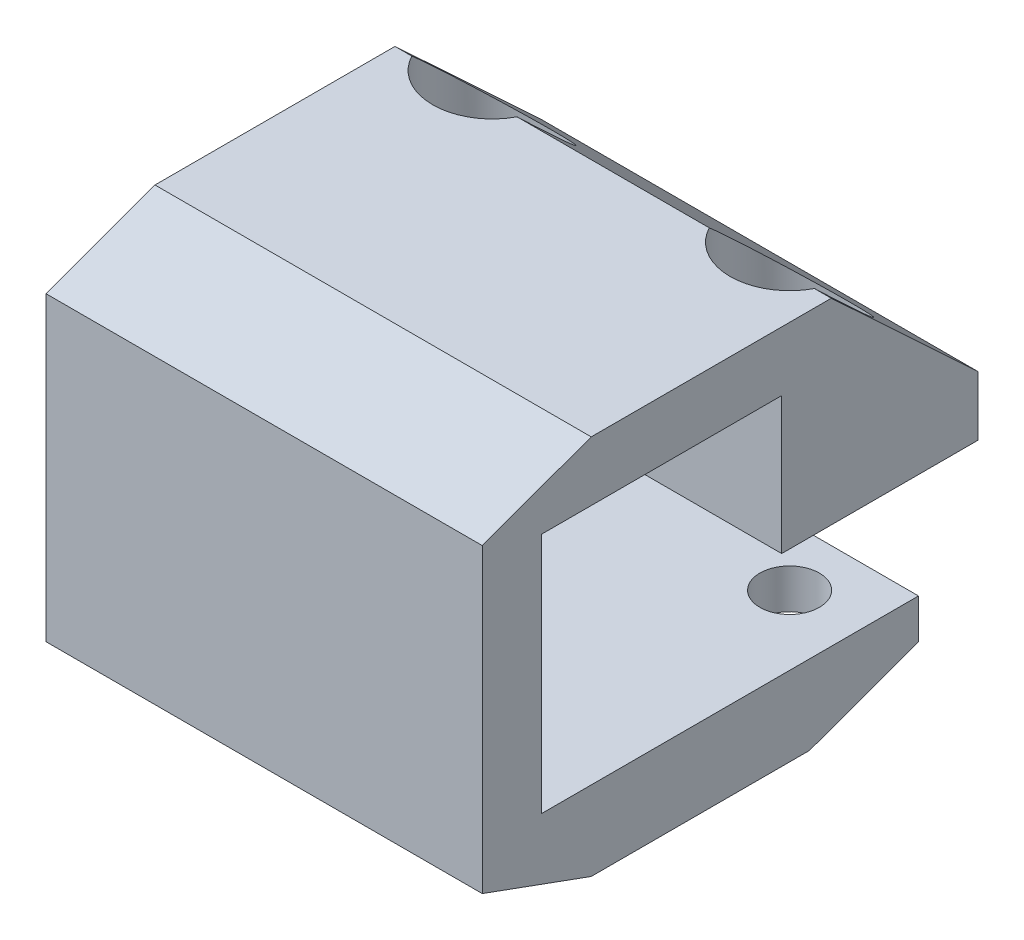
from build123d import *

# Parameters (mm, degrees)
SALIENTE_EXTRUIR1_DEPTH = 22
CROQUIS2_R              = 1.5
CORTAR_EXTRUIR1_DEPTH   = 33.348054431
SALIENTE_EXTRUIR2_START = -9
SALIENTE_EXTRUIR2_DEPTH = 4
CHAFL_N1_SIZE           = 2
CHAFL_N1_SIZE_2         = 5.494954839
CORTAR_EXTRUIR2_DEPTH   = 2
CHAFL_N2_SIZE           = 2
CHAFL_N2_SIZE2          = 5.494954839
CROQUIS5_R              = 3
CORTAR_EXTRUIR3_DEPTH   = 6.9


with BuildPart() as part:
    # Croquis1 → Saliente-Extruir1 (new body)
    with BuildSketch(Plane(origin=(0, 0, 0), x_dir=(0, 0, -1), z_dir=(1, 0, 0))):
        Polygon((0, -3.67871106), (10.9196489, -3.67871106), (10.9196489, -7.67871106), (-11.0803511, -7.67871106), (-11.0803511, 11.52128894), (6.5196489, 11.52128894), (13.9196489, 4.62128894), (13.9196489, 1.62128894), (4.0196489, 1.62128894), (4.0196489, 8.52128894), (-8.0803511, 8.52128894), (-8.0803511, -3.67871106), align=None)
    extrude(amount=SALIENTE_EXTRUIR1_DEPTH)

    # Croquis2 → Cortar-Extruir1 (cut, through all)
    with BuildSketch(Plane.XZ.offset(7.67871106)):
        with Locations(Location((3.5, -7.9196489, 0), (0, 0, 270))):
            Circle(CROQUIS2_R)
        with Locations(Location((18.5, -7.9196489, 0), (0, 0, 270))):
            Circle(CROQUIS2_R)
    extrude(amount=-CORTAR_EXTRUIR1_DEPTH, mode=Mode.SUBTRACT)

    # Croquis3 → Saliente-Extruir2 (add)
    with BuildSketch(Plane(origin=(22, 0, 0), x_dir=(0, 0, -1), z_dir=(1, 0, 0)).offset(SALIENTE_EXTRUIR2_START)):
        with BuildLine():
            Line((-8.0803511, 8.52128894), (-8.0803511, 3.52128894))
            ThreePointArc((-8.0803511, 3.52128894), (-7.378728322, 6.349249529), (-5.436595366, 8.52128894))
            Line((-5.436595366, 8.52128894), (-8.0803511, 8.52128894))
        make_face()
        with BuildLine():
            Line((4.0196489, 8.52128894), (4.0196489, 3.52128894))
            ThreePointArc((4.0196489, 3.52128894), (3.318026122, 6.349249529), (1.375893166, 8.52128894))
            Line((1.375893166, 8.52128894), (4.0196489, 8.52128894))
        make_face()
    extrude(amount=-SALIENTE_EXTRUIR2_DEPTH)

    # Chaflán1
    # the kernel refuses this chamfer: 5.494954839, 2 mm, written as the material it takes off along each edge
    with BuildSketch(Plane(origin=(-14.254982899, -7.67871106, -10.9196489), x_dir=(0, 0.9950833631817486, -0.09904090225205035), z_dir=(1, 0, 0))) as chafl_n1_piece_1:
        Polygon((CHAFL_N1_SIZE * 0.995083363182, CHAFL_N1_SIZE * 0.0990409022521), (-CHAFL_N1_SIZE_2 * 0.0990409022504, CHAFL_N1_SIZE_2 * 0.995083363165), (0, 0), align=None)
    extrude(amount=50.509965797, mode=Mode.SUBTRACT)

    # Croquis4 → Cortar-Extruir2 (cut)
    with BuildSketch(Plane.XZ.offset(7.67871106)):
        Polygon((3.5, -4.686487393), (0.7, -6.303068146), (0.7, -9.536229654), (3.5, -11.152810408), (6.3, -9.536229654), (6.3, -6.303068146), align=None)
        Polygon((18.5, -4.686487393), (15.7, -6.303068146), (15.7, -9.536229654), (18.5, -11.152810408), (21.3, -9.536229654), (21.3, -6.303068146), align=None)
    extrude(amount=-CORTAR_EXTRUIR2_DEPTH, mode=Mode.SUBTRACT)

    # Chaflán2
    chafl_n2_edges = [part.edges().sort_by_distance(p)[0] for p in [
        (11, -7.67871106, 11.0803511),
        (11, 11.52128894, 11.0803511),
    ]]
    chafl_n2_side = [part.faces().sort_by_distance(p)[0] for p in [
        (11, 1.92128894, 11.0803511),
    ]]
    chamfer(chafl_n2_edges, length=CHAFL_N2_SIZE, length2=CHAFL_N2_SIZE2, reference=chafl_n2_side[0])

    # Croquis5 → Cortar-Extruir3 (cut)
    with BuildSketch(Plane(origin=(0, 11.52128894, 0), x_dir=(1, 0, 0), z_dir=(0, 1, 0))):
        with Locations(Location((3.5, 7.9196489, 0), (0, 0, 270))):
            Circle(CROQUIS5_R)
        with Locations(Location((18.5, 7.9196489, 0), (0, 0, 270))):
            Circle(CROQUIS5_R)
    extrude(amount=-CORTAR_EXTRUIR3_DEPTH, mode=Mode.SUBTRACT)


solid = part.part
